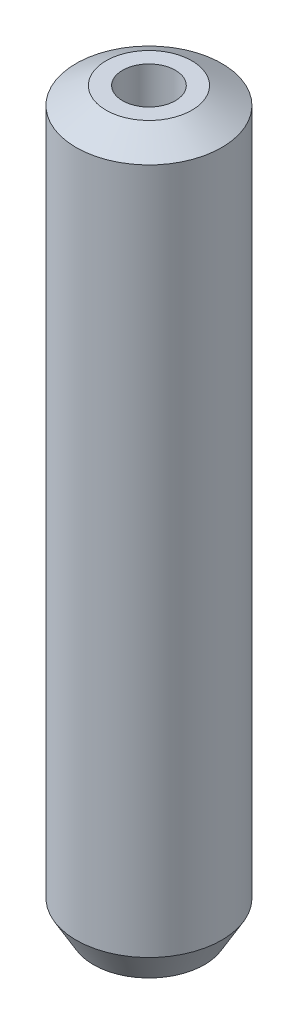
from build123d import *
from OCP.BRepFilletAPI import BRepFilletAPI_MakeChamfer

# Parameters (mm, degrees)
SKETCH1_R           = 22.5
BOSS_EXTRUDE1_DEPTH = 226.603959033
SKETCH2_R           = 8.159850673
CUT_EXTRUDE1_DEPTH  = 229.827127433
CHAMFER1_SIZE       = 5.345521423
CHAMFER1_SIZE2      = 9.258714698


with BuildPart() as part:
    # Sketch1 → Boss-Extrude1 (new body)
    with BuildSketch(Plane(origin=(0, 0, 0), x_dir=(1, 0, 0), z_dir=(0, 1, 0))):
        Circle(SKETCH1_R)
    extrude(amount=BOSS_EXTRUDE1_DEPTH)

    # Sketch2 → Cut-Extrude1 (cut, through all)
    with BuildSketch(Plane(origin=(0, 0, 0), x_dir=(1, 0, 0), z_dir=(0, 1, 0))):
        Circle(SKETCH2_R)
    extrude(amount=CUT_EXTRUDE1_DEPTH, mode=Mode.SUBTRACT)

    # Chamfer1: one chamfer whose edges measure the first distance from different faces: ONE call of the kernel's chamfer builder (chamfer() names one face for all edges)
    chamfer1_edges_1 = [part.edges().sort_by_distance(p)[0] for p in [
        (-22.5, 226.603959033, 0),
    ]]
    chamfer1_side_1 = [part.faces().sort_by_distance(p)[0] for p in [
        (-22.5, 113.301979516, 0),
    ]]
    chamfer1_edges_2 = [part.edges().sort_by_distance(p)[0] for p in [
        (-22.5, 0, 0),
    ]]
    chamfer1_side_2 = [part.faces().sort_by_distance(p)[0] for p in [
        (-21.863603897, 0, 0),
    ]]
    chamfer1 = BRepFilletAPI_MakeChamfer(part.part.solid().wrapped)
    for e in chamfer1_edges_1:
        chamfer1.Add(CHAMFER1_SIZE, CHAMFER1_SIZE2, e.wrapped, chamfer1_side_1[0].wrapped)  # the first distance lies on this face
    for e in chamfer1_edges_2:
        chamfer1.Add(CHAMFER1_SIZE, CHAMFER1_SIZE2, e.wrapped, chamfer1_side_2[0].wrapped)  # the first distance lies on this face
    add(Compound.cast(chamfer1.Shape()), mode=Mode.REPLACE)


solid = part.part
